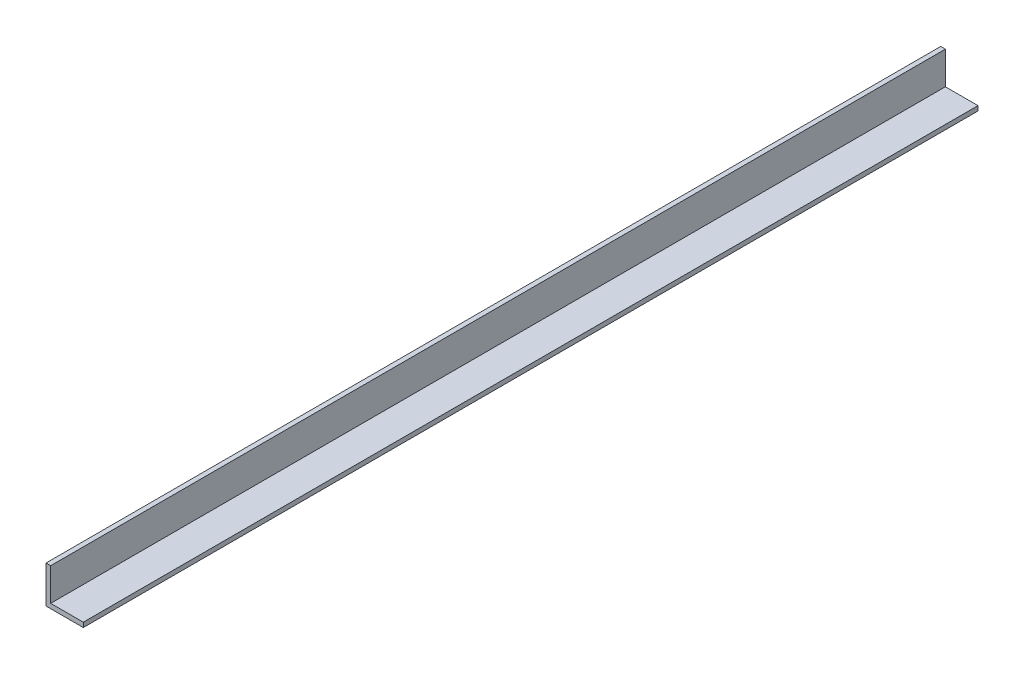
from build123d import *

# Parameters (mm, degrees)
BOSS_EXTRUDE1_DEPTH = 304.8


with BuildPart() as part:
    # Sketch1 → Boss-Extrude1 (new, symmetric)
    with BuildSketch(Plane.XY):
        Polygon((0, 25.4), (0, 0), (25.4, 0), (25.4, 3.175), (3.175, 3.175), (3.175, 25.4), align=None)
    extrude(amount=BOSS_EXTRUDE1_DEPTH, both=True)


solid = part.part
